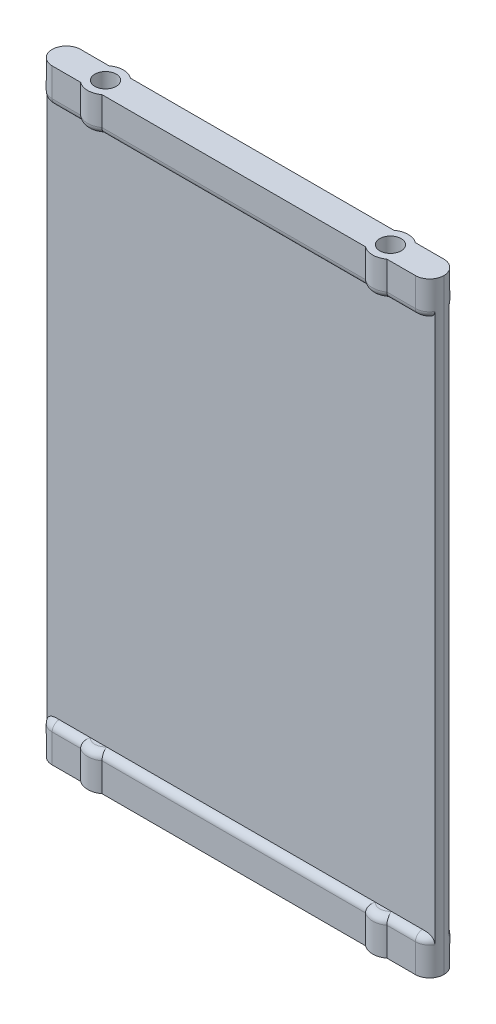
from build123d import *

# Parameters (mm, degrees)
BOSS_EXTRUDE1_DEPTH     = 85
SKETCH2_R               = 1.5000000000000007
CUT_EXTRUDE1_DEPTH      = 2.8
CUT_EXTRUDE2_START      = -2.8
SKETCH3_R               = 1.5000000000000007
CUT_EXTRUDE2_DEPTH      = 2.8
CUT_EXTRUDE3_DEPTH      = 5
CUT_EXTRUDE3_DEPTH_BACK = 1
CUT_EXTRUDE4_DEPTH      = 1
CUT_EXTRUDE4_DEPTH_BACK = 1
FILLET1_R               = 2
FILLET2_R               = 1


with BuildPart() as part:
    # Sketch1 → Boss-Extrude1 (new body)
    with BuildSketch(Plane(origin=(0, 0, 0), x_dir=(1, 0, 0), z_dir=(0, 1, 0))):
        with BuildLine():
            Line((-18.500000000000032, 1.9999999999999996), (-21.500000000000068, 1.9999999999999996))
            ThreePointArc((-21.500000000000053, 1.9999999999999463), (-22.499999999999986, -1.91e-15), (-21.50000000000005, -1.9999999999999476))
            Line((-21.500000000000064, -2.0000000000000004), (-18.500000000000036, -2.0000000000000004))
            ThreePointArc((-18.50000000000003, -2.0000000000000226), (-17.763932022500214, -1.1180339887499129), (-17.499999999999993, -6.1e-16))
            ThreePointArc((-17.499999999999993, 0), (-17.763932022500214, 1.1180339887499113), (-18.500000000000025, 2.0000000000000213))
        make_face()
        with BuildLine():
            ThreePointArc((-18.500000000000025, 2.000000000000021), (-20.00000000000005, 2.4999999999999947), (-21.500000000000053, 1.9999999999999463))
            Line((-21.500000000000068, 1.9999999999999996), (-18.500000000000032, 1.9999999999999996))
        make_face()
        with BuildLine():
            Line((-18.500000000000036, -2.0000000000000004), (-21.500000000000064, -2.0000000000000004))
            ThreePointArc((-21.50000000000005, -1.9999999999999476), (-20.000000000000053, -2.4999999999999947), (-18.50000000000003, -2.0000000000000226))
        make_face()
        with BuildLine():
            Line((-21.500000000000068, 1.9999999999999996), (-27.49999999999999, 1.9999999999999996))
            Line((-27.49999999999999, 1.9999999999999996), (-27.49999999999999, -2.0000000000000004))
            Line((-27.49999999999999, -2.0000000000000004), (-21.500000000000064, -2.0000000000000004))
            ThreePointArc((-21.50000000000005, -1.9999999999999476), (-22.499999999999986, -1.91e-15), (-21.500000000000053, 1.9999999999999463))
        make_face()
        with BuildLine():
            Line((18.49999999999991, 1.9999999999999996), (-18.500000000000032, 1.9999999999999996))
            ThreePointArc((-18.500000000000025, 2.0000000000000213), (-17.763932022500214, 1.1180339887499113), (-17.499999999999993, 0))
            ThreePointArc((-17.499999999999993, -6.1e-16), (-17.763932022500214, -1.1180339887499129), (-18.50000000000003, -2.0000000000000226))
            Line((-18.500000000000036, -2.0000000000000004), (18.499999999999925, -2.0000000000000004))
            ThreePointArc((18.499999999999932, -1.9999999999999478), (17.5, -1.91e-15), (18.49999999999993, 1.9999999999999456))
        make_face()
        with BuildLine():
            ThreePointArc((21.49999999999997, 2.00000000000002), (19.99999999999994, 2.4999999999999982), (18.49999999999993, 1.9999999999999456))
            Line((18.49999999999991, 1.9999999999999996), (21.499999999999968, 1.9999999999999996))
        make_face()
        with BuildLine():
            Line((21.499999999999968, 1.9999999999999996), (18.49999999999991, 1.9999999999999996))
            ThreePointArc((18.49999999999993, 1.9999999999999456), (17.5, -1.91e-15), (18.499999999999932, -1.9999999999999478))
            Line((18.49999999999992, -2.0000000000000004), (21.499999999999954, -2.0000000000000004))
            ThreePointArc((21.499999999999964, -2.0000000000000244), (22.23606797749978, -1.1180339887499124), (22.5, -6.1e-16))
            ThreePointArc((22.5, 0), (22.23606797749978, 1.11803398874991), (21.49999999999997, 2.00000000000002))
        make_face()
        with BuildLine():
            Line((21.499999999999954, -2.0000000000000004), (18.49999999999992, -2.0000000000000004))
            ThreePointArc((18.499999999999932, -1.9999999999999478), (19.999999999999936, -2.4999999999999982), (21.499999999999964, -2.0000000000000244))
        make_face()
        with BuildLine():
            Line((27.50000000000001, 1.9999999999999996), (21.499999999999968, 1.9999999999999996))
            ThreePointArc((21.49999999999997, 2.00000000000002), (22.23606797749978, 1.11803398874991), (22.5, 0))
            ThreePointArc((22.5, -6.1e-16), (22.23606797749978, -1.1180339887499124), (21.499999999999964, -2.0000000000000244))
            Line((21.499999999999954, -2.0000000000000004), (27.50000000000001, -2.0000000000000004))
            Line((27.50000000000001, -2.0000000000000004), (27.50000000000001, 1.9999999999999996))
        make_face()
    extrude(amount=BOSS_EXTRUDE1_DEPTH)

    # Sketch2 → Cut-Extrude1 (cut)
    with BuildSketch(Plane(origin=(0, 85, 0), x_dir=(1, 0, 0), z_dir=(0, 1, 0))):
        with Locations(Location((-19.99999999999999, 0, 0), (0, 0, 270))):
            Circle(SKETCH2_R)
        with Locations(Location((20, 0, 0), (0, 0, 270))):
            Circle(SKETCH2_R)
    extrude(amount=-CUT_EXTRUDE1_DEPTH, mode=Mode.SUBTRACT)

    # Sketch3 → Cut-Extrude2 (cut)
    with BuildSketch(Plane.XZ.offset(CUT_EXTRUDE2_START)):
        with Locations(Location((-19.99999999999999, 0, 0), (0, 0, 90))):
            Circle(SKETCH3_R)
        with Locations(Location((20, 0, 0), (0, 0, 90))):
            Circle(SKETCH3_R)
    extrude(amount=CUT_EXTRUDE2_DEPTH, mode=Mode.SUBTRACT)

    # Sketch4 → Cut-Extrude3 (cut, two sides: drawn at the far end of the back side and taken through both)
    with BuildSketch(Plane.XY.offset(2.0000000000000004).offset(-CUT_EXTRUDE3_DEPTH_BACK)):
        Polygon((-27.500000000000018, 80), (27.500000000000007, 80), (27.50000000000001, 4.999999999999997), (-27.50000000000001, 4.999999999999997), align=None)
    extrude(amount=CUT_EXTRUDE3_DEPTH + CUT_EXTRUDE3_DEPTH_BACK, mode=Mode.SUBTRACT)

    # Sketch5 → Cut-Extrude4 (cut, two sides: drawn at the far end of the back side and taken through both)
    with BuildSketch(Plane(origin=(0, 0, -1.9999999999999996), x_dir=(-1, 0, 0), z_dir=(0, 0, -1)).offset(-CUT_EXTRUDE4_DEPTH_BACK)):
        Polygon((-27.49999999999999, 80.00000000000001), (27.49999999999999, 80.00000000000001), (27.49999999999999, 5.0000000000000115), (-27.499999999999982, 5.0000000000000115), align=None)
    extrude(amount=CUT_EXTRUDE4_DEPTH + CUT_EXTRUDE4_DEPTH_BACK, mode=Mode.SUBTRACT)

    # Fillet1
    fillet1_edges = [part.edges().sort_by_distance(p)[0] for p in [
        (-27.49999999999999, 82.5, 2.0000000000000004),
    ]]
    fillet(fillet1_edges, radius=FILLET1_R)
    fillet1_2_edges = [part.edges().sort_by_distance(p)[0] for p in [
        (-27.49999999999999, 2.5000000000000058, -1.9999999999999996),
    ]]
    fillet(fillet1_2_edges, radius=FILLET1_R - 0.0004)  # a hair under: the kernel refuses the full size
    fillet1_3_edges = [part.edges().sort_by_distance(p)[0] for p in [
        (27.50000000000001, 82.5, 2.0000000000000004),
    ]]
    fillet(fillet1_3_edges, radius=FILLET1_R)
    fillet1_4_edges = [part.edges().sort_by_distance(p)[0] for p in [
        (27.50000000000001, 2.5000000000000058, -1.9999999999999996),
    ]]
    fillet(fillet1_4_edges, radius=FILLET1_R - 0.0004)  # a hair under: the kernel refuses the full size

    # Fillet2
    fillet2_edges = [part.edges().sort_by_distance(p)[0] for p in [
        (-19.999999999999986, 80.00000000000001, -2.499999999999992),
        (19.999999999999996, 80.00000000000001, -2.500000000000009),
        (19.999999999999996, 5.0000000000000115, -2.500000000000009),
        (-19.999999999999986, 5.0000000000000115, -2.499999999999992),
        (-5.684e-14, 80.00000000000001, -1.9999999999999996),
        (23.50019999999999, 5.0000000000000115, -1.9999999999999996),
        (-5.329e-14, 5.0000000000000115, -1.9999999999999996),
        (23.500200169244646, 80.00000000000001, -1.9999999999999996),
        (-26.5002999949995, 80.00000000000001, -1.7320466614179624),
        (26.50030014156478, 80.00000000000001, -1.7320465767871778),
        (-23.500200000000024, 5.0000000000000115, -1.9999999999999996),
        (-26.500299994999484, 5.0000000000000115, -1.7320466614179728),
        (26.500299994999494, 5.0000000000000115, -1.7320466614179786),
        (-23.500000000000025, 4.999999999999997, 2.0000000000000004),
        (-26.49999999999999, 5, 1.7320508075688776),
        (26.500000103238282, 5, 1.7320507479642298),
        (23.499999999999982, 80, 2.0000000000000004),
        (-26.499999999999982, 80, 1.7320508075688823),
        (26.50000000000001, 80, 1.732050807568878),
        (-20.000000000000053, 80, 2.4999999999999925),
        (-23.50000000000002, 80, 2.0000000000000004),
        (19.999999999999932, 80, 2.499999999999999),
        (-5.329e-14, 80, 2.0000000000000004),
        (-20.000000000000053, 4.999999999999997, 2.4999999999999925),
        (-5.507e-14, 4.999999999999997, 2.0000000000000004),
        (19.999999999999932, 4.999999999999997, 2.499999999999999),
        (23.500000119209272, 4.999999999999997, 2.0000000000000004),
        (-23.500200000000024, 80.00000000000001, -1.9999999999999996),
    ]]
    fillet(fillet2_edges, radius=FILLET2_R - 0.0001)  # a hair under: the kernel refuses the full size


solid = part.part
